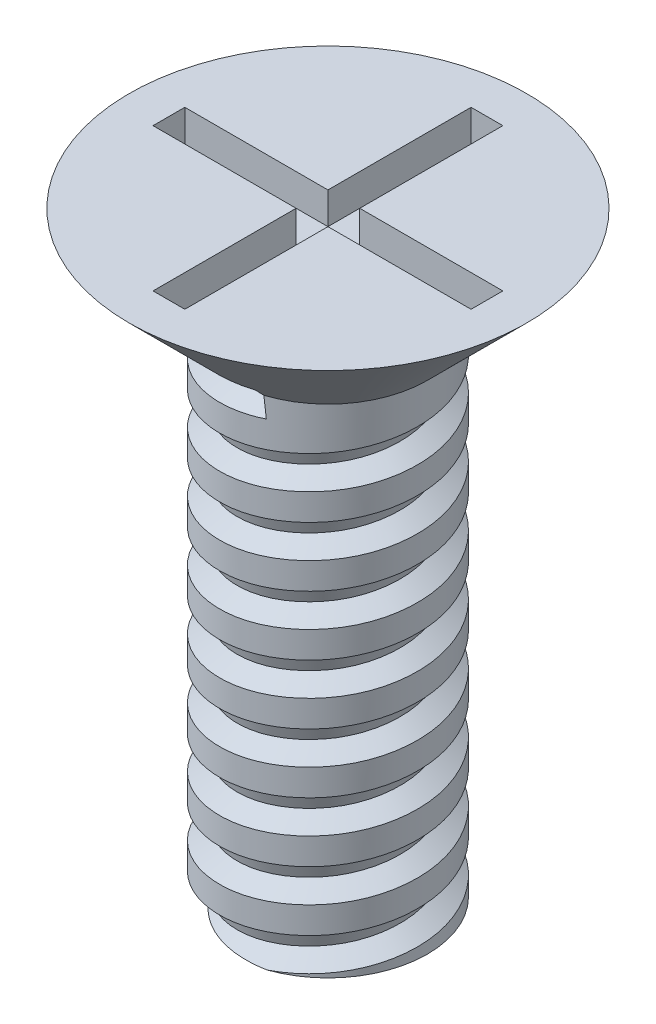
from build123d import *

# Parameters (mm, degrees)
SKETCH1_R           = 5
BOSS_EXTRUDE5_DEPTH = 15
SKETCH4_R           = 5
SKETCH4_R_2         = 2.5
CUT_EXTRUDE2_DEPTH  = 12
CHAMFER7_SIZE       = 3
SKETCH5_W           = 0.8
SKETCH5_H           = 8
CUT_EXTRUDE3_DEPTH  = 0.8
CUT_EXTRUDE5_DEPTH  = 0.8
CUT_SWEEP7_PITCH    = 1.5


with BuildPart() as part:
    # Sketch1 → Boss-Extrude5 (new body)
    with BuildSketch(Plane(origin=(0, 0, 0), x_dir=(1, 0, 0), z_dir=(0, 1, 0))):
        with Locations(Location((0, 0, 0), (0, 0, 270))):
            Circle(SKETCH1_R)
    extrude(amount=BOSS_EXTRUDE5_DEPTH)

    # Sketch4 → Cut-Extrude2 (cut)
    with BuildSketch(Plane.XZ):
        with Locations(Location((0, 0, 0), (0, 0, 270))):
            Circle(SKETCH4_R)
        with Locations(Location((0, 0, 0), (0, 0, 270))):
            Circle(SKETCH4_R_2, mode=Mode.SUBTRACT)
    extrude(amount=-CUT_EXTRUDE2_DEPTH, mode=Mode.SUBTRACT)

    # Chamfer7
    # the kernel refuses this chamfer: 3 mm, written as the material it takes off along each edge
    with BuildSketch(Plane(origin=(0, 12, 0), x_dir=(0, 0, 1), z_dir=(-1, 0, 0))) as chamfer7_piece_1_section:
        Polygon((5, CHAMFER7_SIZE), (5 - CHAMFER7_SIZE, 0), (5, 0), align=None)
    chamfer7_piece_1 = revolve(axis=Axis((0, 12, 0), (0, 1, 0)), mode=Mode.PRIVATE)
    chamfer7_piece_1 = chamfer7_piece_1 - Plane(origin=(0, 12, 0), x_dir=(0, 0, -1), z_dir=(0, -1, 0)) * Cylinder(2.5, 20, mode=Mode.PRIVATE)
    add(chamfer7_piece_1, mode=Mode.SUBTRACT)

    # Sketch5 → Cut-Extrude3 (cut)
    with BuildSketch(Plane(origin=(0, 15, 0), x_dir=(1, 0, 0), z_dir=(0, 1, 0))):
        Rectangle(SKETCH5_W, SKETCH5_H)
    extrude(amount=-CUT_EXTRUDE3_DEPTH, mode=Mode.SUBTRACT)

    # Sketch6 → Cut-Extrude5 (cut)
    with BuildSketch(Plane(origin=(0, 15, 0), x_dir=(1, 0, 0), z_dir=(0, 1, 0))):
        Polygon((4, 0), (0, 0), (-4, 0), (-4, -0.4), (4, -0.4), align=None)
        Polygon((-4, 0), (0, 0), (4, 0), (4, 0.4), (-4, 0.4), align=None)
    extrude(amount=-CUT_EXTRUDE5_DEPTH, mode=Mode.SUBTRACT)

    # Cut-Sweep7: arcs per turn and ends read off the stored shape
    # Cut-Sweep7: the profile of Sketch17 screwed along a right-hand helix through 9.300003 turns, 8 arcs to a turn; built about Z, then put on its axis
    cut_sweep7_z = Axis((0, 0, 0), (0, 0, 1))
    cut_sweep7_corners = [(2.514310105, 0.044041974, -1.961206469), (2.063793258, 0.014903465, -1.656068723), (2.216099303, -0.034831125, -1.135249307), (2.760746462, -0.036430285, -1.118502951), (2.945050873, 0.012315971, -1.62897255)]
    with BuildLine(mode=Mode.PRIVATE) as cut_sweep7_profile:
        Line(cut_sweep7_corners[0], cut_sweep7_corners[1])
        Line(cut_sweep7_corners[1], cut_sweep7_corners[2])
        Line(cut_sweep7_corners[2], cut_sweep7_corners[3])
        Line(cut_sweep7_corners[3], cut_sweep7_corners[4])
        Line(cut_sweep7_corners[4], cut_sweep7_corners[0])
    cut_sweep7_cap = Face(cut_sweep7_profile.wire())
    cut_sweep7_turn_angles = [0, 22.5, 45, 67.5, 90, 112.5, 135, 157.5, 180, 202.5, 225, 247.5, 270, 292.5, 315, 337.5, 360]
    cut_sweep7_turn_weights = [1, 0.9238795325112867, 1, 0.9238795325112867, 1, 0.9238795325112867, 1, 0.9238795325112867, 1, 0.9238795325112867, 1, 0.9238795325112867, 1, 0.9238795325112867, 1, 0.9238795325112867, 1]
    cut_sweep7_turn_rails = [Edge.make_bspline([Vector(p[0], p[1], 0).rotate(cut_sweep7_z, cut_sweep7_turn_angles[k]) / cut_sweep7_turn_weights[k] + Vector(0, 0, p[2] + CUT_SWEEP7_PITCH * cut_sweep7_turn_angles[k] / 360) for k in range(17)], [0, 0, 0, 1, 1, 2, 2, 3, 3, 4, 4, 5, 5, 6, 6, 7, 7, 8, 8, 8], 2, cut_sweep7_turn_weights) for p in cut_sweep7_corners]
    cut_sweep7_turn_sides = [Face.make_surface_from_curves(cut_sweep7_turn_rails[p[0]], cut_sweep7_turn_rails[p[1]]) for p in [(0, 1), (1, 2), (2, 3), (3, 4), (4, 0)]]
    cut_sweep7_last_angles = [3240, 3262.5, 3285, 3307.5, 3330, 3339.0005, 3348.001]
    cut_sweep7_last_weights = [1, 0.9238795325112867, 1, 0.9238795325112867, 1, 0.9876869754092898, 1]
    cut_sweep7_last_rails = [Edge.make_bspline([Vector(p[0], p[1], 0).rotate(cut_sweep7_z, cut_sweep7_last_angles[k]) / cut_sweep7_last_weights[k] + Vector(0, 0, p[2] + CUT_SWEEP7_PITCH * cut_sweep7_last_angles[k] / 360) for k in range(7)], [0, 0, 0, 1, 1, 2, 2, 3, 3, 3], 2, cut_sweep7_last_weights) for p in cut_sweep7_corners]
    cut_sweep7_last_sides = [Face.make_surface_from_curves(cut_sweep7_last_rails[p[0]], cut_sweep7_last_rails[p[1]]) for p in [(0, 1), (1, 2), (2, 3), (3, 4), (4, 0)]]
    cut_sweep7 = Plane(origin=(0, 0, 0), x_dir=(-1, 0, 0), z_dir=(0, 1, 0)) * Solid(Shell([*[p.moved(Location((0, 0, CUT_SWEEP7_PITCH * i))) for i in range(9) for p in cut_sweep7_turn_sides], *cut_sweep7_last_sides, cut_sweep7_cap, cut_sweep7_cap.rotate(cut_sweep7_z, 3348.001).moved(Location((0, 0, CUT_SWEEP7_PITCH * 3348.001 / 360)))]))
    add(cut_sweep7, mode=Mode.SUBTRACT)


solid = part.part
